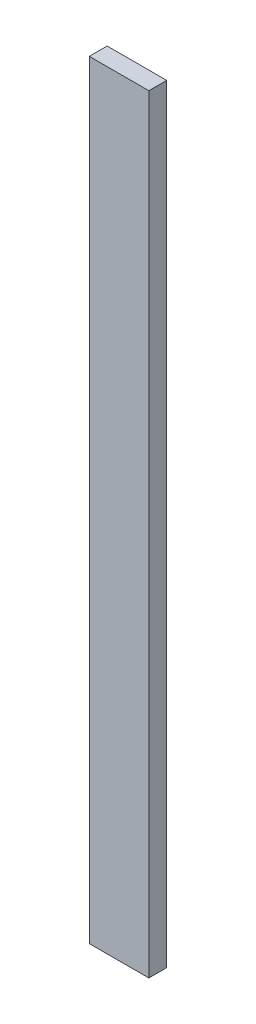
from build123d import *

# Parameters (mm, degrees)
SKETCH1_W           = 63.5
SKETCH1_H           = 819.15
BOSS_EXTRUDE1_DEPTH = 19.05


with BuildPart() as part:
    # Sketch1 → Boss-Extrude1 (new body)
    with BuildSketch(Plane.XY):
        with Locations((-17.391955174, 378.199751696)):
            Rectangle(SKETCH1_W, SKETCH1_H)
    extrude(amount=BOSS_EXTRUDE1_DEPTH)


solid = part.part
